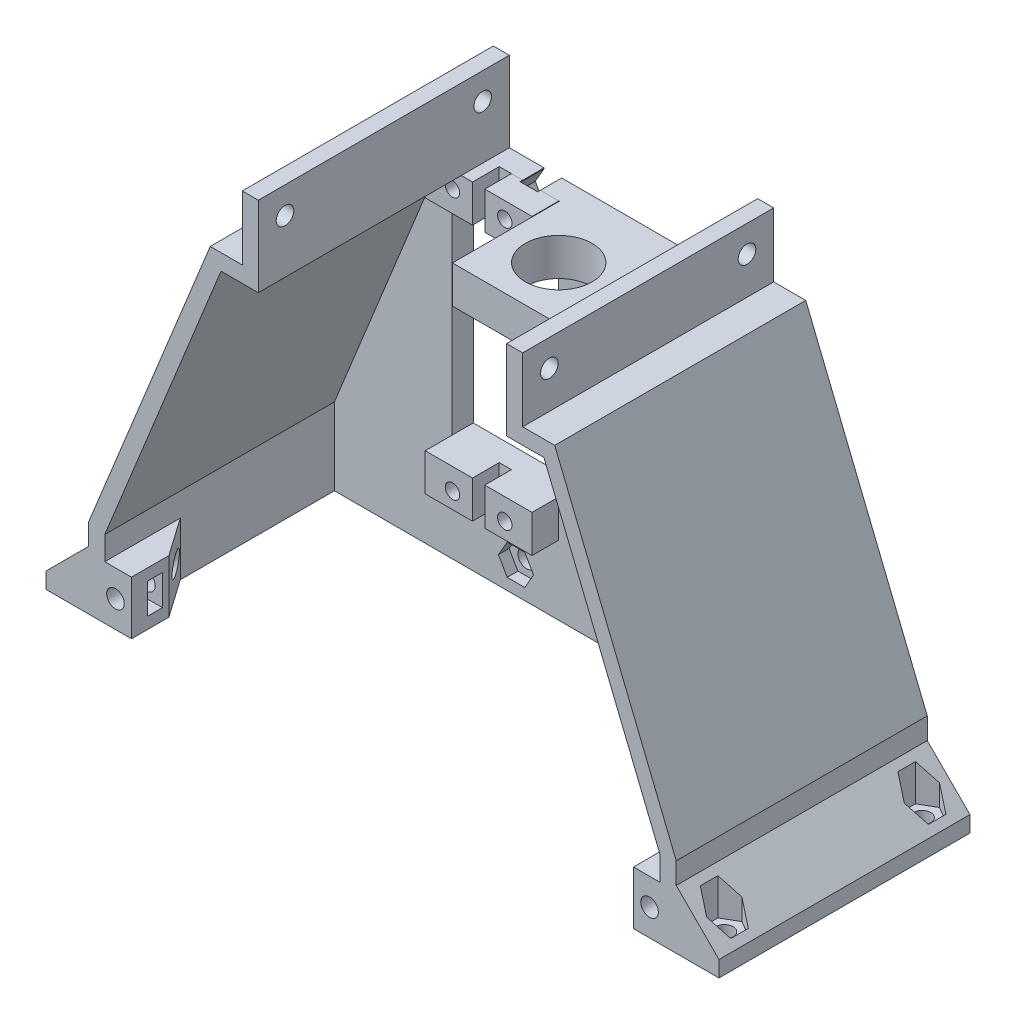
from build123d import *

# Parameters (mm, degrees)
BOSS_EXTRUDE1_DEPTH       = 4
BOSS_EXTRUDE2_DEPTH       = 43
SKETCH2_R                 = 1.65
CUT_EXTRUDE1_DEPTH        = 89
CUT_EXTRUDE2_START        = -4
CUT_EXTRUDE2_OUTLINE_R    = 1.35
CUT_EXTRUDE2_OUTLINE_R_2  = 6.5
CUT_EXTRUDE2_DEPTH        = 4
CUT_EXTRUDE11_START       = -4
CUT_EXTRUDE11_OUTLINE_R   = 7.65
CUT_EXTRUDE11_OUTLINE_R_2 = 6.5
CUT_EXTRUDE11_DEPTH       = 4
BOSS_EXTRUDE6_OUTLINE_R   = 10
BOSS_EXTRUDE6_OUTLINE_R_2 = 6.5
BOSS_EXTRUDE6_DEPTH       = 4
BOSS_EXTRUDE7_START       = 4
BOSS_EXTRUDE7_OUTLINE_R   = 10
BOSS_EXTRUDE7_OUTLINE_R_2 = 7.65
BOSS_EXTRUDE7_DEPTH       = 4
CHAMFER1_SIZE             = 1
BOSS_EXTRUDE3_OUTLINE_R   = 1.35
BOSS_EXTRUDE3_DEPTH       = 5
BOSS_EXTRUDE4_DEPTH       = 47
SKETCH7_R                 = 1.65
CUT_EXTRUDE5_DEPTH        = 23
CUT_EXTRUDE6_START        = -3
SKETCH7_3_R               = 1.65
CUT_EXTRUDE6_DEPTH        = 23
BOSS_EXTRUDE5_DEPTH       = 10
SKETCH9_R                 = 1.65
CUT_EXTRUDE7_DEPTH        = 15
SKETCH10_W                = 2.8
SKETCH10_H                = 5.7
CUT_EXTRUDE8_DEPTH        = 6.5
SKETCH11_R                = 1.65
CUT_EXTRUDE9_DEPTH        = 5
CUT_EXTRUDE10_START       = -2
SKETCH11_3_R              = 1.65
CUT_EXTRUDE10_DEPTH       = 2
CUT_EXTRUDE12_DEPTH       = 4.5
SKETCH13_W                = 19.898058078
SKETCH13_H                = 20
SKETCH13_R                = 6.25
SKETCH13_W_2              = 4
BOSS_EXTRUDE12_DEPTH      = 7
SKETCH13_5_W              = 4
SKETCH13_5_H              = 20
BOSS_EXTRUDE13_DEPTH      = 25
BOSS_EXTRUDE14_DEPTH      = 20
CHAMFER2_SIZE             = 10


# Read off the part's stored shape, not the designer's step: Cut-Extrude2, Cut-Extrude11, Boss-Extrude6, Boss-Extrude7, Boss-Extrude3
with BuildPart() as part:
    # Sketch1 → Boss-Extrude1 (new body)
    with BuildSketch(Plane.XY):
        Polygon((-23.25, 47.5), (-26.25, 47.5), (-26.25, 35.5), (-32.25, 35.5), (-55, -20.5), (-55, -35.5), (55, -35.5), (55, -20.5), (32.25, 35.5), (26.25, 35.5), (26.25, 47.5), (23.25, 47.5), (23.25, 32.5), (-23.25, 32.5), align=None)
    extrude(amount=-BOSS_EXTRUDE1_DEPTH)

    # Sketch1<3> → Boss-Extrude2 (add)
    with BuildSketch(Plane.XY):
        Polygon((-23.25, 47.5), (-26.25, 47.5), (-26.25, 35.5), (-32.25, 35.5), (-55, -20.5), (-55, -35.5), (-52, -35.5), (-52, -31.5), (-52, -21.086115095), (-30.230640743, 32.5), (-23.25, 32.5), align=None)
        Polygon((26.25, 47.5), (23.25, 47.5), (23.25, 32.5), (30.230640743, 32.5), (52, -21.086115095), (52, -31.5), (52, -35.5), (55, -35.5), (55, -20.5), (32.25, 35.5), (26.25, 35.5), align=None)
    extrude(amount=BOSS_EXTRUDE2_DEPTH)

    # Sketch2 → Cut-Extrude1 (cut)
    with BuildSketch(Plane.ZY.offset(26.25)):
        with Locations(Location((38, 42.5, 0), (0, 0, 270))):
            Circle(SKETCH2_R)
        with Locations(Location((1, 42.5, 0), (0, 0, 270))):
            Circle(SKETCH2_R)
    extrude(amount=-CUT_EXTRUDE1_DEPTH, mode=Mode.SUBTRACT)

    # Cut-Extrude2 outline → Cut-Extrude2 (cut)
    with BuildSketch(Plane.XY.offset(CUT_EXTRUDE2_START)):
        with Locations((-24.898237311, 29.500292746)):
            Circle(CUT_EXTRUDE2_OUTLINE_R)
        Polygon((-30.000926191, -15.499402432), (-10.000926227, -15.500597494), (-9.99847635, 25.499402432), (-29.998476314, 25.500597494), align=None)
        with Locations((-15.10116523, -19.500292746)):
            Circle(CUT_EXTRUDE2_OUTLINE_R)
        with Locations((-24.901165212, -19.499707166)):
            Circle(CUT_EXTRUDE2_OUTLINE_R)
        with Locations((-15.098237328, 29.499707166)):
            Circle(CUT_EXTRUDE2_OUTLINE_R)
        with Locations((20, -5.150292746)):
            Circle(CUT_EXTRUDE2_OUTLINE_R_2)
    extrude(amount=CUT_EXTRUDE2_DEPTH, mode=Mode.SUBTRACT)

    # Cut-Extrude11 outline → Cut-Extrude11 (cut)
    with BuildSketch(Plane.XY.offset(CUT_EXTRUDE11_START)):
        with Locations((20, -5.150292746)):
            Circle(CUT_EXTRUDE11_OUTLINE_R)
        with Locations((20, -5.150292746)):
            Circle(CUT_EXTRUDE11_OUTLINE_R_2, mode=Mode.SUBTRACT)
    extrude(amount=CUT_EXTRUDE11_DEPTH, mode=Mode.SUBTRACT)

    # Boss-Extrude6 outline → Boss-Extrude6 (add)
    with BuildSketch(Plane.XY):
        with Locations((20, -5.150292746)):
            Circle(BOSS_EXTRUDE6_OUTLINE_R)
        with Locations((20, -5.150292746)):
            Circle(BOSS_EXTRUDE6_OUTLINE_R_2, mode=Mode.SUBTRACT)
    extrude(amount=BOSS_EXTRUDE6_DEPTH)

    # Boss-Extrude7 outline → Boss-Extrude7 (add)
    with BuildSketch(Plane.XY.offset(BOSS_EXTRUDE7_START)):
        with Locations((20, -5.150292746)):
            Circle(BOSS_EXTRUDE7_OUTLINE_R)
        with Locations((20, -5.150292746)):
            Circle(BOSS_EXTRUDE7_OUTLINE_R_2, mode=Mode.SUBTRACT)
    extrude(amount=BOSS_EXTRUDE7_DEPTH)

    # Chamfer1
    chamfer1_edges = [part.edges().sort_by_distance(p)[0] for p in [
        (13.5, -5.150292746, 0),
    ]]
    chamfer(chamfer1_edges, length=CHAMFER1_SIZE)

    # Boss-Extrude3 outline → Boss-Extrude3 (add)
    # profile 1 of 4: a face of its own
    with BuildSketch(Plane.XY):
        Polygon((-21.148058062, 32.5), (-29.998058078, 32.5), (-29.998476314, 25.500597494), (-21.14847633, 25.500068679), align=None)
        with Locations((-24.898237311, 29.500292746)):
            Circle(BOSS_EXTRUDE3_OUTLINE_R, mode=Mode.SUBTRACT)
    # profile 2 of 4: a face of its own
    with BuildSketch(Plane.XY):
        Polygon((-9.998058078, 32.49940242), (-18.848058062, 32.499931235), (-18.848476334, 25.499931247), (-9.99847635, 25.499402432), align=None)
        with Locations((-15.098237328, 29.499707166)):
            Circle(BOSS_EXTRUDE3_OUTLINE_R, mode=Mode.SUBTRACT)
    # profile 3 of 4: a face of its own
    with BuildSketch(Plane.XY):
        Polygon((-10.001344498, -22.500597482), (-10.000926227, -15.500597494), (-18.850926211, -15.500068679), (-18.851344483, -22.500068667), align=None)
        with Locations((-15.10116523, -19.500292746)):
            Circle(BOSS_EXTRUDE3_OUTLINE_R, mode=Mode.SUBTRACT)
    # profile 4 of 4: a face of its own
    with BuildSketch(Plane.XY):
        Polygon((-21.151344478, -22.499931235), (-21.150926207, -15.499931247), (-30.000926191, -15.499402432), (-30.001344463, -22.49940242), align=None)
        with Locations((-24.901165212, -19.499707166)):
            Circle(BOSS_EXTRUDE3_OUTLINE_R, mode=Mode.SUBTRACT)
    extrude(amount=BOSS_EXTRUDE3_DEPTH)

    # Sketch6 → Boss-Extrude4 (add)
    with BuildSketch(Plane(origin=(0, 0, -4), x_dir=(-1, 0, 0), z_dir=(0, 0, -1))):
        Polygon((55, -35.5), (63, -35.5), (63, -32.5), (55, -24.5), align=None)
    boss_extrude4 = extrude(amount=-BOSS_EXTRUDE4_DEPTH)

    # Sketch7 → Cut-Extrude5 (cut)
    with BuildSketch(Plane(origin=(0, -35.5, 0), x_dir=(-1, 0, 0), z_dir=(0, -1, 0))):
        with Locations(Location((59, -38, 0), (0, 0, 90))):
            Circle(SKETCH7_R)
        with Locations(Location((59, -1, 0), (0, 0, 90))):
            Circle(SKETCH7_R)
    cut_extrude5 = extrude(amount=-CUT_EXTRUDE5_DEPTH, mode=Mode.SUBTRACT)

    # Sketch7<3> → Cut-Extrude6 (cut)
    # profile 1 of 2: a face of its own
    with BuildSketch(Plane(origin=(0, -35.5, 0), x_dir=(-1, 0, 0), z_dir=(0, -1, 0)).offset(CUT_EXTRUDE6_START)):
        Polygon((59, -34.709103466), (56.15, -36.354551733), (56.15, -39.645448267), (59, -41.290896534), (61.85, -39.645448267), (61.85, -36.354551733), align=None)
        with Locations(Location((59, -38, 0), (0, 0, 90))):
            Circle(SKETCH7_3_R, mode=Mode.SUBTRACT)
    # profile 2 of 2: a face of its own
    with BuildSketch(Plane(origin=(0, -35.5, 0), x_dir=(-1, 0, 0), z_dir=(0, -1, 0)).offset(CUT_EXTRUDE6_START)):
        Polygon((59, 2.290896534), (56.15, 0.645448267), (56.15, -2.645448267), (59, -4.290896534), (61.85, -2.645448267), (61.85, 0.645448267), align=None)
        with Locations(Location((59, -1, 0), (0, 0, 90))):
            Circle(SKETCH7_3_R, mode=Mode.SUBTRACT)
    cut_extrude6 = extrude(amount=-CUT_EXTRUDE6_DEPTH, mode=Mode.SUBTRACT)

    # Mirror1: Boss-Extrude4, Cut-Extrude5, Cut-Extrude6 across plane
    add(boss_extrude4.mirror(Plane(origin=(0, 0, 0), x_dir=(0, 0, 1), z_dir=(1, 0, 0))))
    add(cut_extrude5.mirror(Plane(origin=(0, 0, 0), x_dir=(0, 0, 1), z_dir=(1, 0, 0))), mode=Mode.SUBTRACT)
    add(cut_extrude6.mirror(Plane(origin=(0, 0, 0), x_dir=(0, 0, 1), z_dir=(1, 0, 0))), mode=Mode.SUBTRACT)

    # Sketch8 → Boss-Extrude5 (add)
    with BuildSketch(Plane.XZ.offset(35.5)):
        Polygon((-52, 43), (-47, 43), (-47, 36), (-52, 28.859259966), align=None)
    boss_extrude5 = extrude(amount=-BOSS_EXTRUDE5_DEPTH)

    # Sketch9 → Cut-Extrude7 (cut)
    with BuildSketch(Plane.XY.offset(43)):
        with Locations((-50, -30.5)):
            Circle(SKETCH9_R)
    cut_extrude7 = extrude(amount=-CUT_EXTRUDE7_DEPTH, mode=Mode.SUBTRACT)

    # Sketch10 → Cut-Extrude8 (cut)
    with BuildSketch(Plane(origin=(-47, 0, 0), x_dir=(0, 0, -1), z_dir=(1, 0, 0))):
        with Locations((-38.6, -30.5)):
            Rectangle(SKETCH10_W, SKETCH10_H)
    cut_extrude8 = extrude(amount=-CUT_EXTRUDE8_DEPTH, mode=Mode.SUBTRACT)

    # Mirror2: Boss-Extrude5, Cut-Extrude7, Cut-Extrude8 across plane
    add(boss_extrude5.mirror(Plane(origin=(0, 0, 0), x_dir=(0, 0, 1), z_dir=(1, 0, 0))))
    add(cut_extrude7.mirror(Plane(origin=(0, 0, 0), x_dir=(0, 0, 1), z_dir=(1, 0, 0))), mode=Mode.SUBTRACT)
    add(cut_extrude8.mirror(Plane(origin=(0, 0, 0), x_dir=(0, 0, 1), z_dir=(1, 0, 0))), mode=Mode.SUBTRACT)

    # Sketch11 → Cut-Extrude9 (cut)
    with BuildSketch(Plane(origin=(0, 0, -4), x_dir=(-1, 0, 0), z_dir=(0, 0, -1))):
        with Locations((18, -30.5)):
            Circle(SKETCH11_R)
        with Locations((-18, -30.5)):
            Circle(SKETCH11_R)
    extrude(amount=-CUT_EXTRUDE9_DEPTH, mode=Mode.SUBTRACT)

    # Sketch11<3> → Cut-Extrude10 (cut)
    # profile 1 of 2: a face of its own
    with BuildSketch(Plane(origin=(0, 0, -4), x_dir=(-1, 0, 0), z_dir=(0, 0, -1)).offset(CUT_EXTRUDE10_START)):
        Polygon((14.709103466, -30.5), (16.354551733, -33.35), (19.645448267, -33.35), (21.290896534, -30.5), (19.645448267, -27.65), (16.354551733, -27.65), align=None)
        with Locations((18, -30.5)):
            Circle(SKETCH11_3_R, mode=Mode.SUBTRACT)
    # profile 2 of 2: a face of its own
    with BuildSketch(Plane(origin=(0, 0, -4), x_dir=(-1, 0, 0), z_dir=(0, 0, -1)).offset(CUT_EXTRUDE10_START)):
        Polygon((-21.290896534, -30.5), (-19.645448267, -33.35), (-16.354551733, -33.35), (-14.709103466, -30.5), (-16.354551733, -27.65), (-19.645448267, -27.65), align=None)
        with Locations((-18, -30.5)):
            Circle(SKETCH11_3_R, mode=Mode.SUBTRACT)
    extrude(amount=-CUT_EXTRUDE10_DEPTH, mode=Mode.SUBTRACT)

    # Sketch12 → Cut-Extrude12 (cut)
    with BuildSketch(Plane(origin=(0, 0, -4), x_dir=(-1, 0, 0), z_dir=(0, 0, -1))):
        Polygon((13.452789061, 32.349707166), (13.452789061, 32.5), (16.743685595, 32.5), (16.743685595, 32.349707166), (18.389133862, 29.499707166), (16.743685595, 26.649707166), (13.452789061, 26.649707166), (11.807340794, 29.499707166), align=None)
        Polygon((18.392061764, -19.500292746), (16.746613497, -16.650292746), (13.455716963, -16.650292746), (11.810268696, -19.500292746), (13.455716963, -22.350292746), (16.746613497, -22.350292746), align=None)
        Polygon((28.192061747, -19.499707166), (26.54661348, -16.649707166), (23.255716945, -16.649707166), (21.610268678, -19.499707166), (23.255716945, -22.349707166), (26.54661348, -22.349707166), align=None)
        Polygon((24.898237311, 32.791189281), (22.048237311, 31.145741014), (22.048237311, 27.854844479), (24.898237311, 26.209396212), (27.748237311, 27.854844479), (27.748237311, 31.145741014), align=None)
    extrude(amount=-CUT_EXTRUDE12_DEPTH, mode=Mode.SUBTRACT)

    # Sketch13 → Boss-Extrude12 (add)
    # profile 1 of 3: a face of its own
    with BuildSketch(Plane(origin=(0, 32.5, 0), x_dir=(1, 0, 0), z_dir=(0, 1, 0))):
        with Locations((0.050970961, -10)):
            Rectangle(SKETCH13_W, SKETCH13_H)
        with Locations(Location((0, -10, 0), (0, 0, 270))):
            Circle(SKETCH13_R, mode=Mode.SUBTRACT)
    # profile 2 of 3: a face of its own
    with BuildSketch(Plane(origin=(0, 32.5, 0), x_dir=(1, 0, 0), z_dir=(0, 1, 0))):
        with Locations((12, -10)):
            Rectangle(SKETCH13_W_2, SKETCH13_H)
    # profile 3 of 3: a face of its own
    with BuildSketch(Plane(origin=(0, 32.5, 0), x_dir=(1, 0, 0), z_dir=(0, 1, 0))):
        Polygon((23.25, 0), (14, 0), (14, -20), (32.25, -20), (32.25, 0), align=None)
    extrude(amount=-BOSS_EXTRUDE12_DEPTH)

    # Sketch13<5> → Boss-Extrude13 (add)
    with BuildSketch(Plane(origin=(0, 32.5, 0), x_dir=(1, 0, 0), z_dir=(0, 1, 0))):
        with Locations((12, -10)):
            Rectangle(SKETCH13_5_W, SKETCH13_5_H)
    extrude(amount=-BOSS_EXTRUDE13_DEPTH)

    # Sketch16 → Boss-Extrude14 (add)
    with BuildSketch(Plane.XY):
        Polygon((32.25, 25.5), (32.25, 27.52926952), (33.074390743, 25.5), align=None)
    extrude(amount=BOSS_EXTRUDE14_DEPTH)

    # Chamfer2
    chamfer2_edges = [part.edges().sort_by_distance(p)[0] for p in [
        (12, 7.5, 20),
    ]]
    chamfer(chamfer2_edges, length=CHAMFER2_SIZE)


solid = part.part
